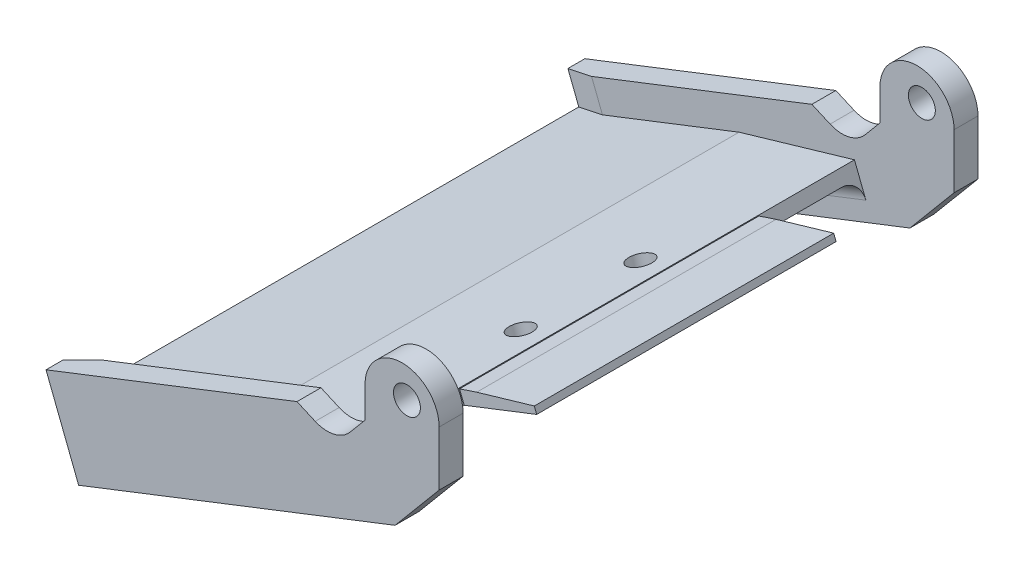
from build123d import *
from OCP.BRepFilletAPI import BRepFilletAPI_MakeChamfer

# Parameters (mm, degrees)
ESTRUSIONE_ESTRUSIONE1_DEPTH = 4
ESTRUSIONE_ESTRUSIONE2_DEPTH = 82
ESTRUSIONE_ESTRUSIONE3_START = 4
ESTRUSIONE_ESTRUSIONE3_DEPTH = 4
FORO_PER_VITE_M4_1_D         = 4.5
FORO_PER_VITE_M4_1_DEPTH     = 188
FORO_PER_VITE_M4_1_TIP       = 1.351936393
SCHIZZO6_W                   = 50
SCHIZZO6_H                   = 4
ESTRUSIONE_ESTRUSIONE4_DEPTH = 5
SMUSSO1_SIZE                 = 5.5
SMUSSO1_SIZE2                = 1.169061089
RACCORDO1_R                  = 3
SMUSSO2_SIZE                 = 5
RACCORDO2_START              = -86
RACCORDO2_DEPTH              = 4
RACCORDO2_2_DEPTH            = 4
SCHIZZO7_W                   = 50
SCHIZZO7_H                   = 2.5
ESTRUSIONE_ESTRUSIONE5_DEPTH = 13
SMUSSO3_SIZE                 = 20
SMUSSO3_SIZE_2               = 1.048155586
SMUSSO4_SIZE                 = 20
SMUSSO4_SIZE2                = 1.749773271
SMUSSO5_SIZE                 = 10
SMUSSO5_SIZE2                = 0.350328071
SCHIZZO8_R                   = 2
TAGLIO_ESTRUSIONE1_DEPTH     = 10


with BuildPart() as part:
    # Schizzo1 → Estrusione-Estrusione1 (new body)
    with BuildSketch(Plane.XY):
        with BuildLine():
            Line((4.891723927, 5.829729564), (4.891723927, 11.038087105))
            ThreePointArc((4.891723927, 11.038087105), (11.08058435, 17.226947528), (17.269444773, 11.038087105))
            Line((17.269444773, 11.038087105), (17.269444773, 1.912236928))
            Line((17.269444773, 1.912236928), (9.899185428, -6.871296125))
            Line((9.899185428, -6.871296125), (-42.94312967, -27.493410377))
            Line((-42.94312967, -27.493410377), (-46.57866514, -18.177677349))
            Line((-46.57866514, -18.177677349), (0, 0))
            Line((0, 0), (4.891723927, 5.829729564))
        make_face()
    extrude(amount=ESTRUSIONE_ESTRUSIONE1_DEPTH)

    # Schizzo4 → Estrusione-Estrusione2 (add)
    with BuildSketch(Plane.XY):
        Polygon((-45.124450952, -21.90397056), (1.454214188, -3.726293211), (0, 0), (-46.57866514, -18.177677349), align=None)
    extrude(amount=-ESTRUSIONE_ESTRUSIONE2_DEPTH)

    # Schizzo5 → Estrusione-Estrusione3 (add)
    with BuildSketch(Plane(origin=(0, 0, -82), x_dir=(-1, 0, 0), z_dir=(0, 0, -1)).offset(ESTRUSIONE_ESTRUSIONE3_START)):
        with BuildLine():
            Line((42.94312967, -27.493410377), (46.57866514, -18.177677349))
            Line((46.57866514, -18.177677349), (0, 0))
            Line((0, 0), (-4.891723927, 5.829729564))
            Line((-4.891723927, 5.829729564), (-4.891723927, 11.038087105))
            ThreePointArc((-4.891723927, 11.038087105), (-11.08058435, 17.226947528), (-17.269444773, 11.038087105))
            Line((-17.269444773, 11.038087105), (-17.269444773, 1.912236928))
            Line((-17.269444773, 1.912236928), (-9.899185428, -6.871296125))
            Line((-9.899185428, -6.871296125), (42.94312967, -27.493410377))
        make_face()
    extrude(amount=-ESTRUSIONE_ESTRUSIONE3_DEPTH)

    # Foro per Vite M4-1
    with Locations(Plane.XY.offset(4)):
        with Locations((11.891723927, 12.226947528)):
            Hole(FORO_PER_VITE_M4_1_D / 2, depth=FORO_PER_VITE_M4_1_DEPTH)
            with Locations((0, 0, -(FORO_PER_VITE_M4_1_DEPTH + FORO_PER_VITE_M4_1_TIP / 2))):  # 118° drill point
                Cone(0, FORO_PER_VITE_M4_1_D / 2, FORO_PER_VITE_M4_1_TIP, mode=Mode.SUBTRACT)

    # Schizzo6 → Estrusione-Estrusione4 (add)
    with BuildSketch(Plane(origin=(0, 0, 0), x_dir=(0.9315733027957475, 0.36355354697516373, 0), z_dir=(-0.36355354697516373, 0.9315733027957475, 0))):
        with Locations((-25, 84)):
            Rectangle(SCHIZZO6_W, SCHIZZO6_H)
        with Locations((-25, -2)):
            Rectangle(SCHIZZO6_W, SCHIZZO6_H)
    extrude(amount=ESTRUSIONE_ESTRUSIONE4_DEPTH)

    # Smusso1: one chamfer whose edges measure the first distance from different faces: ONE call of the kernel's chamfer builder (chamfer() names one face for all edges)
    smusso1_edges_1 = [part.edges().sort_by_distance(p)[0] for p in [
        (-47.487549007, -15.848744092, -82),
    ]]
    smusso1_side_1 = [part.faces().sort_by_distance(p)[0] for p in [
        (-24.198216437, -6.759905417, -82),
    ]]
    smusso1_edges_2 = [part.edges().sort_by_distance(p)[0] for p in [
        (-47.487549007, -15.848744092, 0),
    ]]
    smusso1_side_2 = [part.faces().sort_by_distance(p)[0] for p in [
        (-24.198216437, -6.759905417, 0),
    ]]
    smusso1 = BRepFilletAPI_MakeChamfer(part.part.solid().wrapped)
    for e in smusso1_edges_1:
        smusso1.Add(SMUSSO1_SIZE, SMUSSO1_SIZE2, e.wrapped, smusso1_side_1[0].wrapped)  # the first distance lies on this face
    for e in smusso1_edges_2:
        smusso1.Add(SMUSSO1_SIZE, SMUSSO1_SIZE2, e.wrapped, smusso1_side_2[0].wrapped)  # the first distance lies on this face
    add(Compound.cast(smusso1.Shape()), mode=Mode.REPLACE)

    # Raccordo1
    raccordo1_edges = [part.edges().sort_by_distance(p)[0] for p in [
        (-21.835118382, -12.815131886, -82),
        (-21.835118382, -12.815131886, 0),
    ]]
    fillet(raccordo1_edges, radius=RACCORDO1_R)

    # Smusso2
    smusso2_edges = [part.edges().sort_by_distance(p)[0] for p in [
        (-1.817767735, 4.657866514, 2),
        (-1.817767735, 4.657866514, -84),
    ]]
    chamfer(smusso2_edges, length=SMUSSO2_SIZE - 0.0001)  # a hair under: the kernel refuses the full size

    # Raccordo2: read off the stored shape, not the designer's step
    # Raccordo2 outline → Raccordo2 (add)
    with BuildSketch(Plane.XY.offset(RACCORDO2_START)):
        with BuildLine():
            Line((0, 0), (2.407895765, 2.869618428))
            ThreePointArc((2.407895765, 2.869618428), (-0.284030607, 1.214852073), (-3.430579557, 1.504591587))
            Line((-3.430579557, 1.504591587), (0, 0))
        make_face()
    extrude(amount=RACCORDO2_DEPTH)

    # Raccordo2 2 outline → Raccordo2 2 (add)
    with BuildSketch(Plane.XY):
        with BuildLine():
            Line((0, 0), (2.407895765, 2.869618428))
            ThreePointArc((2.407895765, 2.869618428), (-0.284030607, 1.214852073), (-3.430579557, 1.504591587))
            Line((-3.430579557, 1.504591587), (0, 0))
        make_face()
    extrude(amount=RACCORDO2_2_DEPTH)

    # Schizzo7 → Estrusione-Estrusione5 (add)
    with BuildSketch(Plane(origin=(0, 0, 0), x_dir=(0, 0, -1), z_dir=(0.9315733027957472, 0.3635535469751644, 0))):
        with Locations((41, -2.75)):
            Rectangle(SCHIZZO7_W, SCHIZZO7_H)
    extrude(amount=ESTRUSIONE_ESTRUSIONE5_DEPTH)

    # Smusso3
    # the kernel refuses this chamfer: 20, 1.048155586 mm, written as the material it takes off along each edge
    with BuildSketch(Plane(origin=(12.655783257, 3.328836156, -16), x_dir=(-0.9315733027957472, -0.3635535469751644, 0), z_dir=(0, 0, -1))) as smusso3_piece_1_section:
        Polygon((SMUSSO3_SIZE, 0), (0, -SMUSSO3_SIZE_2), (0, 0), align=None)
    smusso3_piece_1 = extrude(amount=50, mode=Mode.PRIVATE)
    smusso3_piece_1 = split(smusso3_piece_1, bisect_by=Plane(origin=(0.54533032, -1.397359954, -16), z_dir=(0.9315733027957472, 0.36355354697516445, 0)), keep=Keep.TOP, mode=Mode.PRIVATE)
    add(smusso3_piece_1, mode=Mode.SUBTRACT)

    # Smusso4
    smusso4_edges = [part.edges().sort_by_distance(p)[0] for p in [
        (0, 0, -41),
    ]]
    smusso4_side = [part.faces().sort_by_distance(p)[0] for p in [
        (-23.323124739, -9.102026325, -41),
    ]]
    chamfer(smusso4_edges, length=SMUSSO4_SIZE, length2=SMUSSO4_SIZE2, reference=smusso4_side[0])

    # Smusso5
    smusso5_edges = [part.edges().sort_by_distance(p)[0] for p in [
        (13.036843938, 2.352402395, -41),
    ]]
    smusso5_side = [part.faces().sort_by_distance(p)[0] for p in [
        (6.857772748, 0.306645312, -41),
    ]]
    chamfer(smusso5_edges, length=SMUSSO5_SIZE, length2=SMUSSO5_SIZE2, reference=smusso5_side[0])

    # Schizzo8 → Taglio-Estrusione1 (cut)
    with BuildSketch(Plane(origin=(0.489777192, -1.672892017, 0), x_dir=(0.9597141645441053, 0.2809781528400562, 0), z_dir=(-0.2809781528400562, 0.9597141645441053, 0))):
        with Locations(Location((-4.796849429, 31, 0), (0, 0, 180))):
            Circle(SCHIZZO8_R)
        with Locations(Location((-4.796849429, 51, 0), (0, 0, 180))):
            Circle(SCHIZZO8_R)
    extrude(amount=-TAGLIO_ESTRUSIONE1_DEPTH, mode=Mode.SUBTRACT)


solid = part.part
